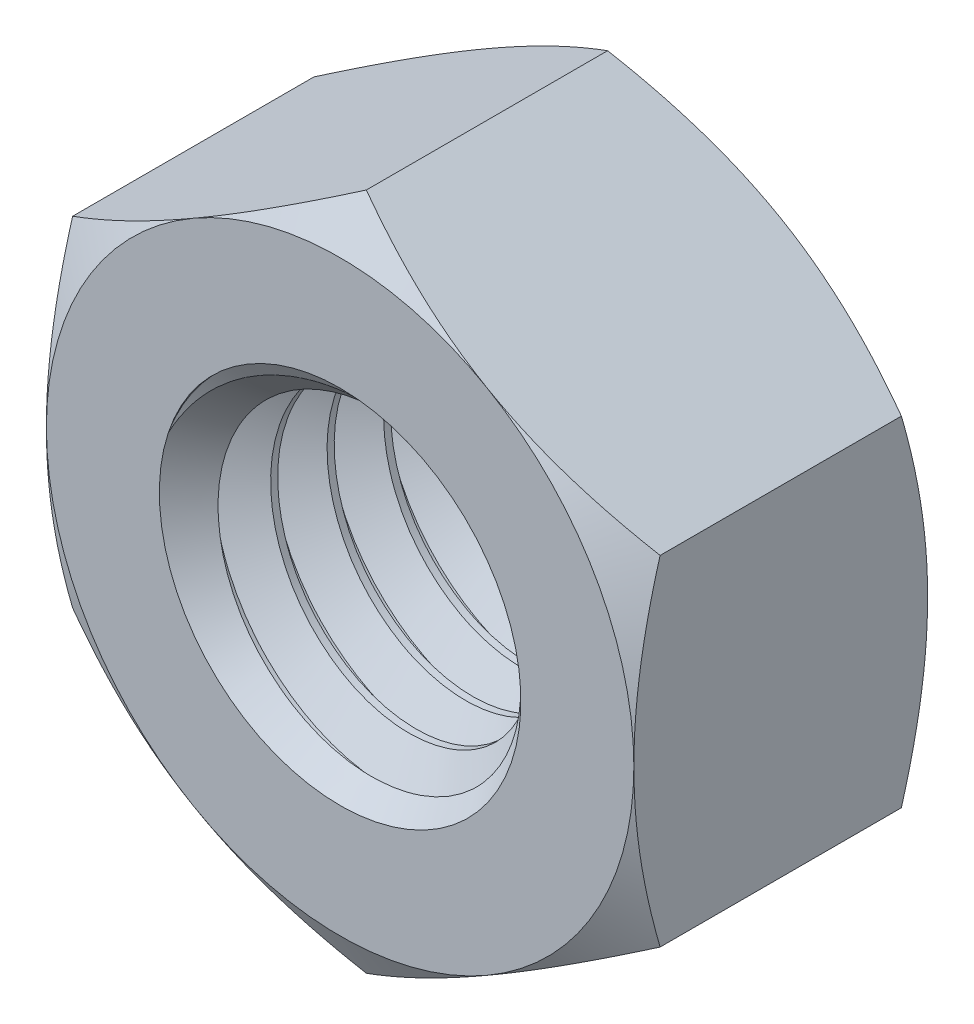
from build123d import *

# Parameters (mm, degrees)
EXTRUDE1_DEPTH          = 3.25
SKETCH13_R              = 4
BOSS_EXTRUDE1_DEPTH     = 6.5
CUT_SWEEP1_PITCH        = 1.25
SKETCH7_OUTSIDE_W       = 107.168
SKETCH7_OUTSIDE_H       = 109.18
SKETCH7_OUTSIDE_R       = 6.5
EXTRUDE2_DEPTH          = 25.4
EXTRUDE2_DRAFT          = -60
MIRROR2_COPY_1_SKETCH_W = 107.168
MIRROR2_COPY_1_SKETCH_H = 109.18
MIRROR2_COPY_1_SKETCH_R = 6.5
MIRROR2_COPY_1_DEPTH    = 25.4
MIRROR2_COPY_1_DRAFT    = -60


with BuildPart() as part:
    # Sketch1 → Extrude1 (new, symmetric)
    with BuildSketch(Plane.XY):
        Polygon((-6.5, 3.75277675), (-6.5, -3.75277675), (0, -7.505553499), (6.5, -3.75277675), (6.5, 3.75277675), (0, 7.505553499), align=None)
    extrude(amount=EXTRUDE1_DEPTH, both=True)

    # Cut-Extrude2 cone 1 section (through the dimple's axis) → Cut-Extrude2 (revolve, cut)
    with BuildSketch(Plane(origin=(0, 0, 3.25), x_dir=(0, -1, 0), z_dir=(1, 0, 0))):
        Polygon((0, 0), (4, 0), (0, 4), align=None)
    revolve(axis=Axis((0, 0, 3.25), (0, 0, -1)), mode=Mode.SUBTRACT)

    # Cut-Extrude3 cone 1 section (through the dimple's axis) → Cut-Extrude3 (revolve, cut)
    with BuildSketch(Plane(origin=(0, 0, -3.25), x_dir=(0, 1, 0), z_dir=(1, 0, 0))):
        Polygon((0, 0), (4, 0), (0, 4), align=None)
    revolve(axis=Axis((0, 0, -3.25), (0, 0, 1)), mode=Mode.SUBTRACT)


with BuildPart() as body_2:
    # Sketch13 → Boss-Extrude1 (new body)
    with BuildSketch(Plane(origin=(0, 0, -3.25), x_dir=(-1, 0, 0), z_dir=(0, 0, -1))):
        Circle(SKETCH13_R)
    extrude(amount=-BOSS_EXTRUDE1_DEPTH)

    # Cut-Sweep1: arcs per turn and ends read off the stored shape
    # Cut-Sweep1: the profile of Sketch12 profile screwed along a right-hand helix through 7 turns, 8 arcs to a turn; built about Z, then put on its axis
    cut_sweep1_z = Axis((0, 0, 0), (0, 0, 1))
    cut_sweep1_corners = [(4.0003, 0, -2.343923205), (4.0003, 0, -1.249826795), (3.188101184, 0, -1.71875), (3.188101184, 0, -1.875)]
    with BuildLine(mode=Mode.PRIVATE) as cut_sweep1_profile:
        Line(cut_sweep1_corners[0], cut_sweep1_corners[1])
        Line(cut_sweep1_corners[1], cut_sweep1_corners[2])
        Line(cut_sweep1_corners[2], cut_sweep1_corners[3])
        Line(cut_sweep1_corners[3], cut_sweep1_corners[0])
    cut_sweep1_cap = Face(cut_sweep1_profile.wire())
    cut_sweep1_turn_angles = [0, 22.5, 45, 67.5, 90, 112.5, 135, 157.5, 180, 202.5, 225, 247.5, 270, 292.5, 315, 337.5, 360]
    cut_sweep1_turn_weights = [1, 0.9238795325112867, 1, 0.9238795325112867, 1, 0.9238795325112867, 1, 0.9238795325112867, 1, 0.9238795325112867, 1, 0.9238795325112867, 1, 0.9238795325112867, 1, 0.9238795325112867, 1]
    cut_sweep1_turn_rails = [Edge.make_bspline([Vector(p[0], p[1], 0).rotate(cut_sweep1_z, cut_sweep1_turn_angles[k]) / cut_sweep1_turn_weights[k] + Vector(0, 0, p[2] + CUT_SWEEP1_PITCH * cut_sweep1_turn_angles[k] / 360) for k in range(17)], [0, 0, 0, 1, 1, 2, 2, 3, 3, 4, 4, 5, 5, 6, 6, 7, 7, 8, 8, 8], 2, cut_sweep1_turn_weights) for p in cut_sweep1_corners]
    cut_sweep1_turn_sides = [Face.make_surface_from_curves(cut_sweep1_turn_rails[p[0]], cut_sweep1_turn_rails[p[1]]) for p in [(0, 1), (1, 2), (2, 3), (3, 0)]]
    cut_sweep1 = Plane(origin=(0, 0, -3.25), x_dir=(0, 1, 0), z_dir=(0, 0, 1)) * Solid(Shell([*[p.moved(Location((0, 0, CUT_SWEEP1_PITCH * i))) for i in range(7) for p in cut_sweep1_turn_sides], cut_sweep1_cap, cut_sweep1_cap.rotate(cut_sweep1_z, 2520).moved(Location((0, 0, CUT_SWEEP1_PITCH * 2520 / 360)))]))
    add(cut_sweep1, mode=Mode.SUBTRACT)


with BuildPart() as part_1:
    add(part.part)

    # Combine1: cut body 2
    add(body_2.part, mode=Mode.SUBTRACT)


with BuildPart() as extrude2_tool:
    # Sketch7 outside → Extrude2 (with draft: the straight prism first)
    with BuildSketch(Plane.XY.offset(3.25)):
        Rectangle(SKETCH7_OUTSIDE_W, SKETCH7_OUTSIDE_H)
        Circle(SKETCH7_OUTSIDE_R, mode=Mode.SUBTRACT)
    extrude(amount=-EXTRUDE2_DEPTH)
    # Extrude2: the draft: its side faces are tilted about the plane it starts from
    extrude2_sides = [extrude2_tool.faces().sort_by_distance(p)[0] for p in [
        (0, -54.59, -9.45),
        (53.584, 0, -9.45),
        (0, 54.59, -9.45),
        (-53.584, 0, -9.45),
        (-6.5, 0, -9.45),
    ]]
    draft(extrude2_sides, Plane.XY.offset(3.25), EXTRUDE2_DRAFT)


with BuildPart() as part_2:
    add(part_1.part)

    # Extrude2: cut by extrude2_tool
    add(extrude2_tool.part, mode=Mode.SUBTRACT)


with BuildPart() as mirror2_copy_1_tool:
    # Mirror2 copy 1 sketch → Mirror2 copy 1 (with draft: the straight prism first)
    with BuildSketch(Plane(origin=(0, 0, -3.25), x_dir=(1, 0, 0), z_dir=(0, 0, -1))):
        Rectangle(MIRROR2_COPY_1_SKETCH_W, MIRROR2_COPY_1_SKETCH_H)
        Circle(MIRROR2_COPY_1_SKETCH_R, mode=Mode.SUBTRACT)
    extrude(amount=-MIRROR2_COPY_1_DEPTH)
    # Mirror2 copy 1: the draft: its side faces are tilted about the plane it starts from
    mirror2_copy_1_sides = [mirror2_copy_1_tool.faces().sort_by_distance(p)[0] for p in [
        (0, -54.59, 9.45),
        (53.584, 0, 9.45),
        (0, 54.59, 9.45),
        (-53.584, 0, 9.45),
        (-6.5, 0, 9.45),
    ]]
    draft(mirror2_copy_1_sides, Plane(origin=(0, 0, -3.25), x_dir=(1, 0, 0), z_dir=(0, 0, -1)), MIRROR2_COPY_1_DRAFT)


with BuildPart() as part_3:
    add(part_2.part)

    # Mirror2 copy 1: cut by mirror2_copy_1_tool
    add(mirror2_copy_1_tool.part, mode=Mode.SUBTRACT)


solid = part_3.part
